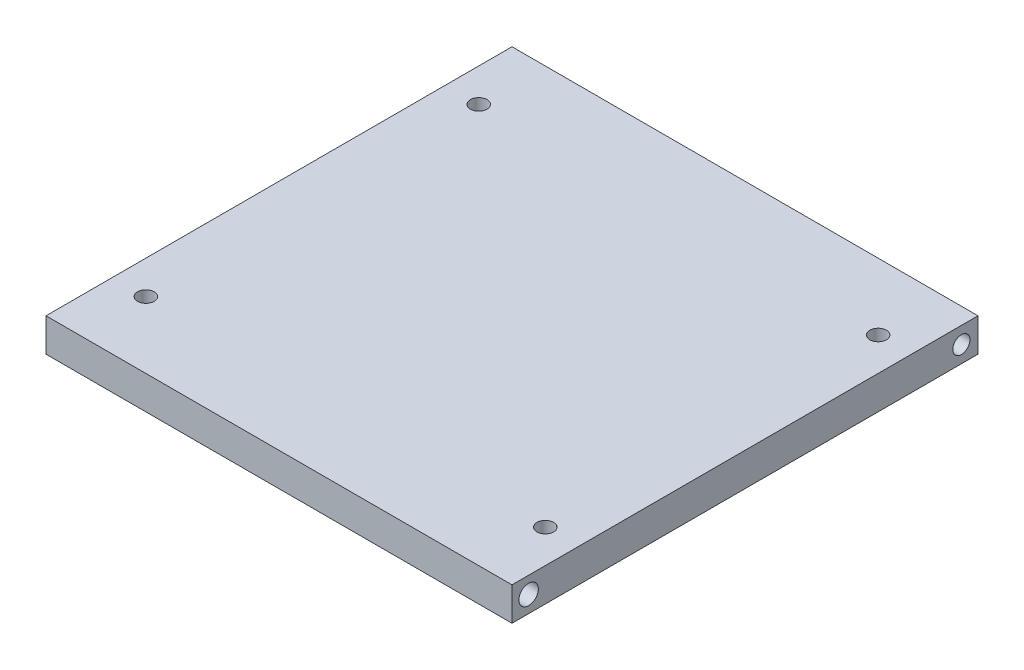
from build123d import *

# Parameters (mm, degrees)
SKETCH1_W            = 84
SKETCH1_H            = 84
BOSS_EXTRUDE1_DEPTH  = 6
SKETCH2_R            = 1.5
CUT_EXTRUDE1_DEPTH   = 6
LPATTERN1_COUNT      = 2
LPATTERN1_PITCH      = 72
LPATTERN1_COUNT_DIR2 = 2
LPATTERN1_PITCH_DIR2 = 60
SKETCH3_R            = 1.549904247
SKETCH3_R_2          = 1.748244363
CUT_EXTRUDE2_DEPTH   = 10


with BuildPart() as part:
    # Sketch1 → Boss-Extrude1 (new body)
    with BuildSketch(Plane(origin=(0, 0, 0), x_dir=(1, 0, 0), z_dir=(0, 1, 0))):
        with Locations((42, 42)):
            Rectangle(SKETCH1_W, SKETCH1_H)
    extrude(amount=BOSS_EXTRUDE1_DEPTH)

    # Sketch2 → Cut-Extrude1 (cut)
    with BuildSketch(Plane(origin=(0, 6, 0), x_dir=(1, 0, 0), z_dir=(0, 1, 0))):
        with Locations((6, 72)):
            Circle(SKETCH2_R)
    cut_extrude1 = extrude(amount=-CUT_EXTRUDE1_DEPTH, mode=Mode.SUBTRACT)

    # LPattern1: Cut-Extrude1 2 × 2
    with Locations(*[(i * LPATTERN1_PITCH, 0, j * LPATTERN1_PITCH_DIR2) for i in range(LPATTERN1_COUNT) for j in range(LPATTERN1_COUNT_DIR2) if (i, j) != (0, 0)]):
        add(cut_extrude1, mode=Mode.SUBTRACT)

    # Sketch3 → Cut-Extrude2 (cut)
    with BuildSketch(Plane.ZY):
        with Locations((-81, 3)):
            Circle(SKETCH3_R)
        with Locations((-3, 3)):
            Circle(SKETCH3_R_2)
    cut_extrude2 = extrude(amount=-CUT_EXTRUDE2_DEPTH, mode=Mode.SUBTRACT)

    # Mirror1: Cut-Extrude2 across plane
    add(cut_extrude2.mirror(Plane.ZY.offset(-42)), mode=Mode.SUBTRACT)


solid = part.part
